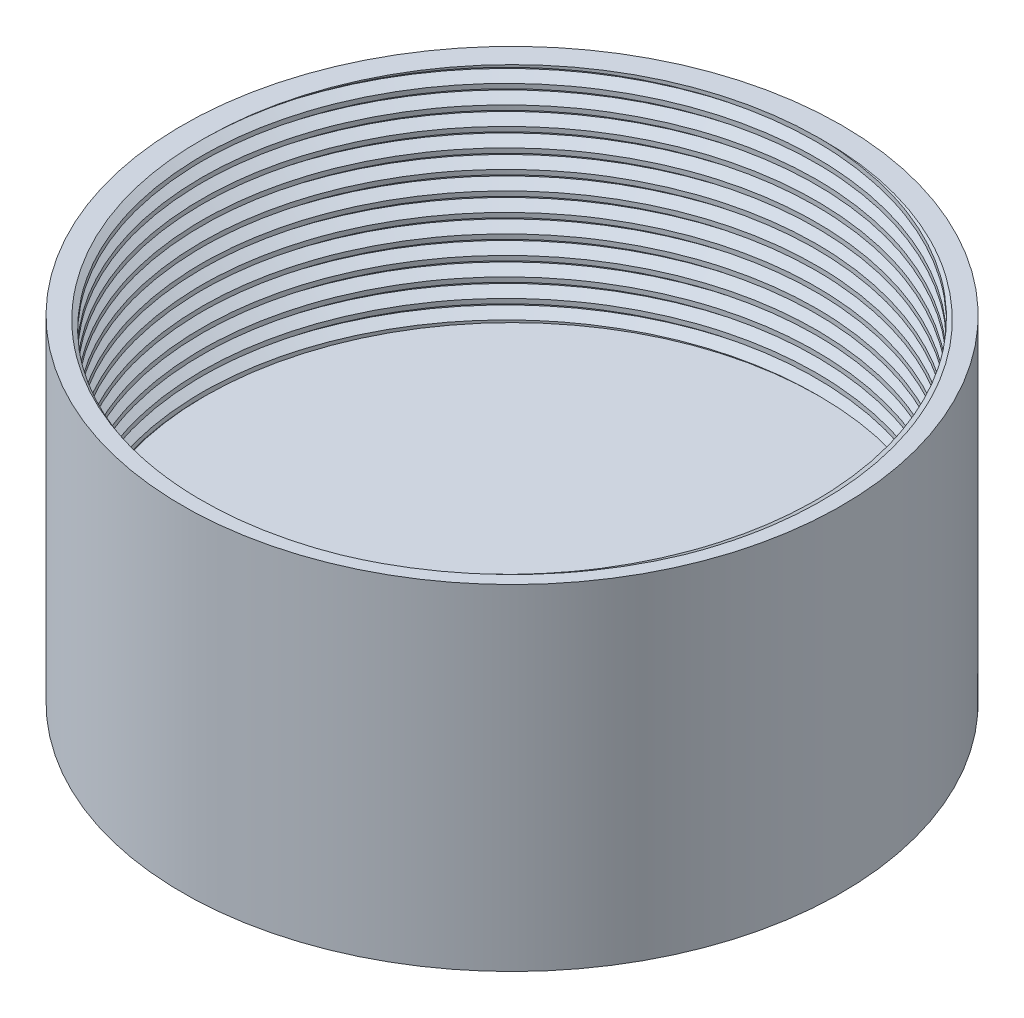
from build123d import *

# Parameters (mm, degrees)
SKETCH1_R           = 37.465
BOSS_EXTRUDE1_DEPTH = 38.1
SKETCH2_R           = 34.925
CUT_EXTRUDE1_DEPTH  = 25.4
THREAD1_PITCH       = 2.116666667


with BuildPart() as part:
    # Sketch1 → Boss-Extrude1 (new body)
    with BuildSketch(Plane(origin=(0, 0, 0), x_dir=(1, 0, 0), z_dir=(0, 1, 0))):
        with Locations(Location((0, 0, 0), (0, 0, 90))):
            Circle(SKETCH1_R)
    extrude(amount=BOSS_EXTRUDE1_DEPTH)

    # Sketch2 → Cut-Extrude1 (cut)
    with BuildSketch(Plane(origin=(0, 38.1, 0), x_dir=(1, 0, 0), z_dir=(0, 1, 0))):
        with Locations(Location((0, 0, 0), (0, 0, 270))):
            Circle(SKETCH2_R)
    extrude(amount=-CUT_EXTRUDE1_DEPTH, mode=Mode.SUBTRACT)

    # Thread1: the profile of Thread Profile1 profile screwed along a right-hand helix of 16.724409 turns, 10 arcs to a turn; built about Z, then put on its axis
    thread1_z = Axis((0, 0, 0), (0, 0, 1))
    thread1_corners = [(34.9247, 0, -0.000173205), (36.070679435, 0, 0.66145833), (36.070679435, 0, 0.926041664), (34.9247, 0, 1.587673199)]
    with BuildLine(mode=Mode.PRIVATE) as thread1_profile:
        Line(thread1_corners[0], thread1_corners[1])
        Line(thread1_corners[1], thread1_corners[2])
        Line(thread1_corners[2], thread1_corners[3])
        Line(thread1_corners[3], thread1_corners[0])
    thread1_cap = Face(thread1_profile.wire())
    thread1_turn_angles = [0, 18, 36, 54, 72, 90, 108, 126, 144, 162, 180, 198, 216, 234, 252, 270, 288, 306, 324, 342, 360]
    thread1_turn_weights = [1, 0.9510565162951535, 1, 0.9510565162951535, 1, 0.9510565162951535, 1, 0.9510565162951535, 1, 0.9510565162951535, 1, 0.9510565162951535, 1, 0.9510565162951535, 1, 0.9510565162951535, 1, 0.9510565162951535, 1, 0.9510565162951535, 1]
    thread1_turn_rails = [Edge.make_bspline([Vector(p[0], p[1], 0).rotate(thread1_z, thread1_turn_angles[k]) / thread1_turn_weights[k] + Vector(0, 0, p[2] + THREAD1_PITCH * thread1_turn_angles[k] / 360) for k in range(21)], [0, 0, 0, 1, 1, 2, 2, 3, 3, 4, 4, 5, 5, 6, 6, 7, 7, 8, 8, 9, 9, 10, 10, 10], 2, thread1_turn_weights) for p in thread1_corners]
    thread1_turn_sides = [Face.make_surface_from_curves(thread1_turn_rails[p[0]], thread1_turn_rails[p[1]]) for p in [(0, 1), (1, 2), (2, 3), (3, 0)]]
    thread1_last_angles = [5760, 5778, 5796, 5814, 5832, 5850, 5868, 5886, 5904, 5922, 5940, 5958, 5976, 5994, 6012, 6016.393700787, 6020.787401575]
    thread1_last_weights = [1, 0.9510565162951535, 1, 0.9510565162951535, 1, 0.9510565162951535, 1, 0.9510565162951535, 1, 0.9510565162951535, 1, 0.9510565162951535, 1, 0.9510565162951535, 1, 0.9970611808444931, 1]
    thread1_last_rails = [Edge.make_bspline([Vector(p[0], p[1], 0).rotate(thread1_z, thread1_last_angles[k]) / thread1_last_weights[k] + Vector(0, 0, p[2] + THREAD1_PITCH * thread1_last_angles[k] / 360) for k in range(17)], [0, 0, 0, 1, 1, 2, 2, 3, 3, 4, 4, 5, 5, 6, 6, 7, 7, 8, 8, 8], 2, thread1_last_weights) for p in thread1_corners]
    thread1_last_sides = [Face.make_surface_from_curves(thread1_last_rails[p[0]], thread1_last_rails[p[1]]) for p in [(0, 1), (1, 2), (2, 3), (3, 0)]]
    thread1 = Plane(origin=(0, 44.45, 0), x_dir=(-1, 0, 0), z_dir=(0, -1, 0)) * Solid(Shell([*[p.moved(Location((0, 0, THREAD1_PITCH * i))) for i in range(16) for p in thread1_turn_sides], *thread1_last_sides, thread1_cap, thread1_cap.rotate(thread1_z, 6020.787401575).moved(Location((0, 0, THREAD1_PITCH * 6020.787401575 / 360)))]))
    add(thread1, mode=Mode.SUBTRACT)


solid = part.part
